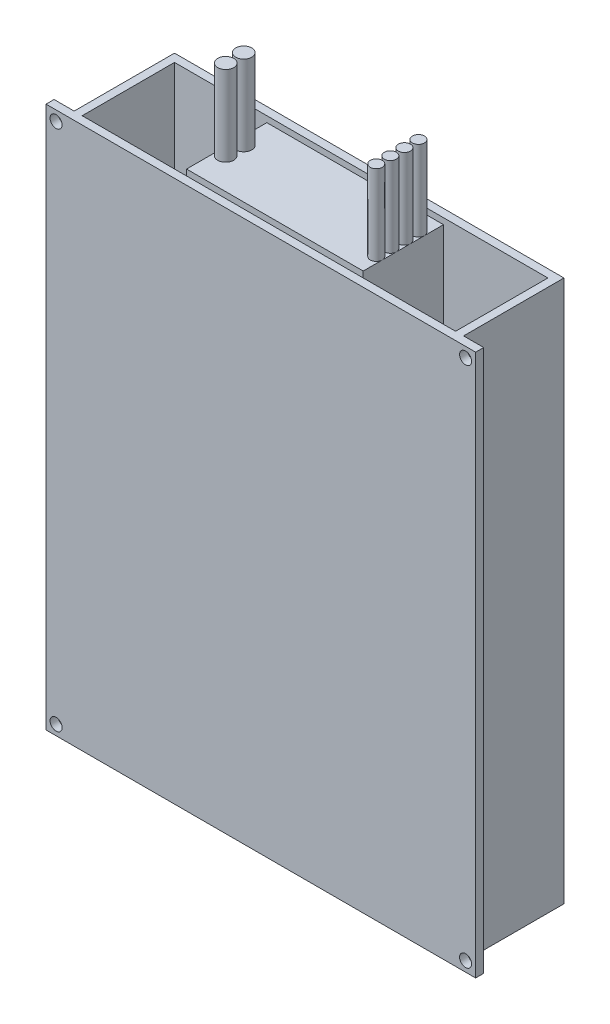
from build123d import *

# Parameters (mm, degrees)
ZEE3200MAH_START         = -170.079725428
ZEE3200MAH_OUTLINE_W     = 20
ZEE3200MAH_OUTLINE_H     = 44
ZEE3200MAH_DEPTH         = 133
ZEE3200MAH_START_2       = -190.079725428
ZEE3200MAH_2_OUTLINE_R   = 1.5
ZEE3200MAH_2_OUTLINE_R_2 = 2
ZEE3200MAH_2_DEPTH       = 20
BODY_MOVE_COPY1_ANGLE    = 120
SKETCH2_W                = 97
SKETCH2_H                = 27
BOSS_EXTRUDE1_DEPTH      = 2
SKETCH2_3_W              = 2
SKETCH2_3_H              = 2
BOSS_EXTRUDE2_DEPTH      = 133
SKETCH4_W                = 5
SKETCH4_H                = 1
SKETCH4_H_2              = 2
BOSS_EXTRUDE4_DEPTH      = 135
SKETCH7_R                = 1.5
CUT_EXTRUDE2_DEPTH       = 190.118044219


# Read off the part's stored shape, not the designer's step: Zee3200mah
with BuildPart() as part:
    # Zee3200mah outline → Zee3200mah (new body)
    with BuildSketch(Plane.YZ.offset(ZEE3200MAH_START)):
        with Locations((10, -33.906773899)):
            Rectangle(ZEE3200MAH_OUTLINE_W, ZEE3200MAH_OUTLINE_H)
    extrude(amount=ZEE3200MAH_DEPTH)

    # Zee3200mah 2 outline → Zee3200mah 2 (add)
    with BuildSketch(Plane.YZ.offset(ZEE3200MAH_START_2)):
        with Locations((15.25, -13.406773899)):
            Circle(ZEE3200MAH_2_OUTLINE_R)
        with Locations((11.75, -13.406773899)):
            Circle(ZEE3200MAH_2_OUTLINE_R)
        with Locations((8.25, -13.406773899)):
            Circle(ZEE3200MAH_2_OUTLINE_R)
        with Locations((4.75, -13.406773899)):
            Circle(ZEE3200MAH_2_OUTLINE_R)
        with Locations((7.75, -53.906773899)):
            Circle(ZEE3200MAH_2_OUTLINE_R_2)
        with Locations((12.25, -53.906773899)):
            Circle(ZEE3200MAH_2_OUTLINE_R_2)
    extrude(amount=ZEE3200MAH_2_DEPTH)


with BuildPart() as part_1:
    # Body-Move/Copy1: moved
    add(part.part.moved(Location((0, 0, 0))).rotate(Axis((-61.584225652, -43.495499776, 18.088725876), (-0.5773502691896245, 0.5773502691896305, -0.5773502691896225)), BODY_MOVE_COPY1_ANGLE))


with BuildPart() as body_2:
    # Sketch2 → Boss-Extrude1 (new body)
    with BuildSketch(Plane.XZ.offset(68)):
        with Locations((-113.579725428, -35.406773899)):
            Rectangle(SKETCH2_W, SKETCH2_H)
    extrude(amount=BOSS_EXTRUDE1_DEPTH)

    # Sketch2<3> → Boss-Extrude2 (add)
    # profile 1 of 2: a face of its own
    with BuildSketch(Plane.XZ.offset(68)):
        Polygon((-65.079725428, -23.906773899), (-67.079725428, -23.906773899), (-67.079725428, -21.906773899), (-162.079725428, -21.906773899), (-162.079725428, -48.906773899), (-65.079725428, -48.906773899), align=None)
        Polygon((-160.079725428, -23.906773899), (-68.579725428, -23.906773899), (-67.079725428, -23.906773899), (-67.079725428, -25.406773899), (-67.079725428, -46.906773899), (-160.079725428, -46.906773899), align=None, mode=Mode.SUBTRACT)
    # profile 2 of 2: a face of its own
    with BuildSketch(Plane.XZ.offset(68)):
        with Locations((-66.079725428, -22.906773899)):
            Rectangle(SKETCH2_3_W, SKETCH2_3_H)
    extrude(amount=-BOSS_EXTRUDE2_DEPTH)

    # Sketch4 → Boss-Extrude4 (add)
    with BuildSketch(Plane.XZ.offset(70)):
        with Locations((-62.579725428, -23.406773899)):
            Rectangle(SKETCH4_W, SKETCH4_H)
        with Locations((-62.579725428, -22.406773899)):
            Rectangle(SKETCH4_W, SKETCH4_H)
        with Locations((-164.579725428, -22.906773899)):
            Rectangle(SKETCH4_W, SKETCH4_H_2)
    extrude(amount=-BOSS_EXTRUDE4_DEPTH)

    # Sketch7 → Cut-Extrude2 (cut, through all)
    with BuildSketch(Plane(origin=(0, 0, -23.906773899), x_dir=(-1, 0, 0), z_dir=(0, 0, -1))):
        with BuildLine():
            ThreePointArc((64.079725428, 62.5), (63.153750577, 63.885819299), (61.519065257, 63.560660172))
            Line((61.519065257, 63.560660172), (63.6403856, 61.439339828))
            ThreePointArc((63.6403856, 61.439339828), (63.965544727, 61.925974851), (64.079725428, 62.5))
        make_face()
        with BuildLine():
            Line((63.6403856, 61.439339828), (61.519065257, 63.560660172))
            ThreePointArc((61.519065257, 63.560660172), (61.519065257, 61.439339828), (63.6403856, 61.439339828))
        make_face()
        with Locations(Location((164.579725428, 62.5, 0), (0, 0, 90))):
            Circle(SKETCH7_R)
        with Locations(Location((62.579725428, -67.5, 0), (0, 0, 90))):
            Circle(SKETCH7_R)
        with Locations(Location((164.579725428, -67.5, 0), (0, 0, 90))):
            Circle(SKETCH7_R)
    extrude(amount=-CUT_EXTRUDE2_DEPTH, mode=Mode.SUBTRACT)


solid = Compound([part_1.part, body_2.part])
